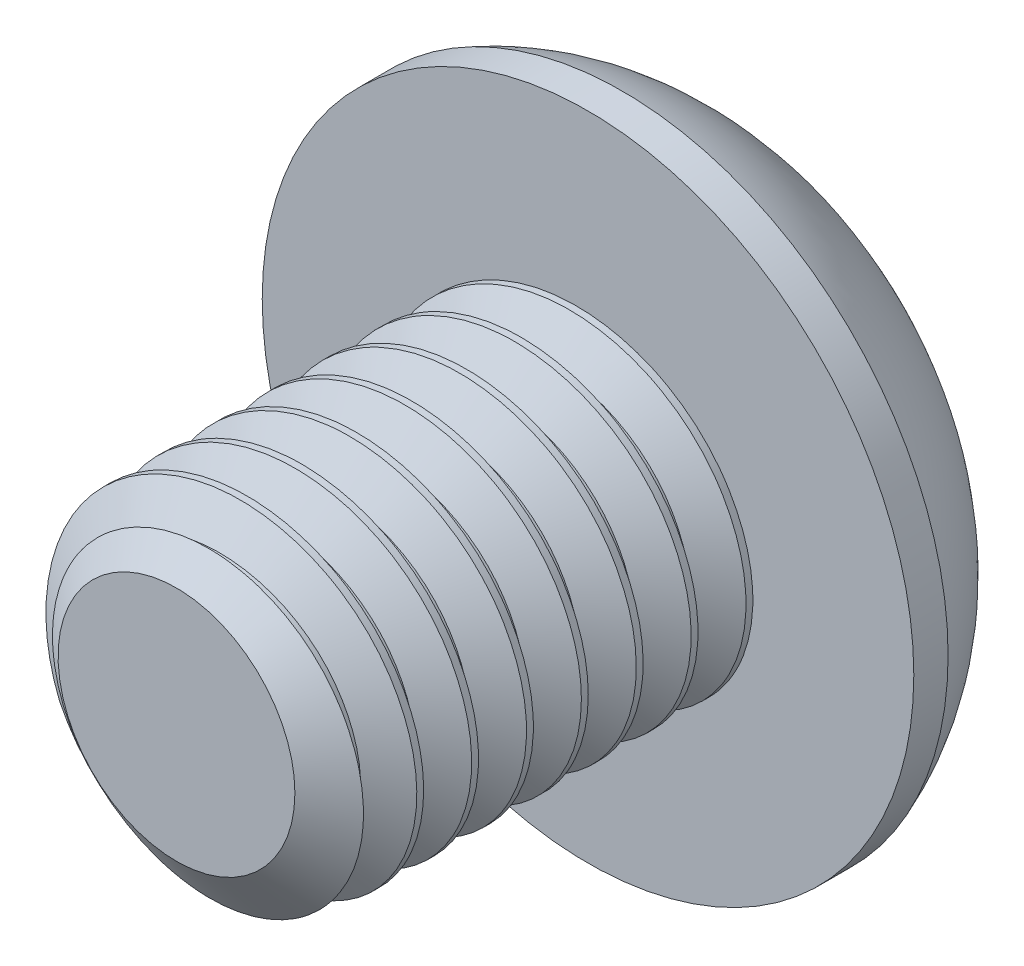
from build123d import *

# Parameters (mm, degrees)
SKETCH1_R          = 2.5
EXTRUDE1_DEPTH     = 6
CUT_SWEEP1_PITCH   = 0.7999999999999978
SKETCH6_R          = 4.75
EXTRUDE2_DEPTH     = 2.75
CUT_EXTRUDE1_DEPTH = 2.25
SKETCH8_R          = 1.7320508075688774
CUT_EXTRUDE2_DEPTH = 12.031205901894861
CUT_EXTRUDE2_TAPER = 45.0000000000001


with BuildPart() as part:
    # Sketch1 → Extrude1 (new body)
    with BuildSketch(Plane.XY):
        Circle(SKETCH1_R)
    extrude(amount=-EXTRUDE1_DEPTH)

    # Cut-Sweep1: the profile of Sketch3 profile screwed along a right-hand helix of 8.5 turns, 6 arcs to a turn; built about Z, then put on its axis
    cut_sweep1_z = Axis((0, 0, 0), (0, 0, 1))
    cut_sweep1_corners = [(2.5003, 0, -0.700173205), (1.980384758, 0, -0.4), (1.980384758, 0, -0.3), (2.5003, 0, 0.000173205)]
    with BuildLine(mode=Mode.PRIVATE) as cut_sweep1_profile:
        Line(cut_sweep1_corners[0], cut_sweep1_corners[1])
        Line(cut_sweep1_corners[1], cut_sweep1_corners[2])
        Line(cut_sweep1_corners[2], cut_sweep1_corners[3])
        Line(cut_sweep1_corners[3], cut_sweep1_corners[0])
    cut_sweep1_cap = Face(cut_sweep1_profile.wire())
    cut_sweep1_turn_angles = [0, 30, 60, 90, 120, 150, 180, 210, 240, 270, 300, 330, 360]
    cut_sweep1_turn_weights = [1, 0.8660254037844387, 1, 0.8660254037844387, 1, 0.8660254037844387, 1, 0.8660254037844387, 1, 0.8660254037844387, 1, 0.8660254037844387, 1]
    cut_sweep1_turn_rails = [Edge.make_bspline([Vector(p[0], p[1], 0).rotate(cut_sweep1_z, cut_sweep1_turn_angles[k]) / cut_sweep1_turn_weights[k] + Vector(0, 0, p[2] + CUT_SWEEP1_PITCH * cut_sweep1_turn_angles[k] / 360) for k in range(13)], [0, 0, 0, 1, 1, 2, 2, 3, 3, 4, 4, 5, 5, 6, 6, 6], 2, cut_sweep1_turn_weights) for p in cut_sweep1_corners]
    cut_sweep1_turn_sides = [Face.make_surface_from_curves(cut_sweep1_turn_rails[p[0]], cut_sweep1_turn_rails[p[1]]) for p in [(0, 1), (1, 2), (2, 3), (3, 0)]]
    cut_sweep1_last_angles = [2880, 2910, 2940, 2970, 3000, 3030, 3060]
    cut_sweep1_last_weights = [1, 0.8660254037844387, 1, 0.8660254037844387, 1, 0.8660254037844287, 1]
    cut_sweep1_last_rails = [Edge.make_bspline([Vector(p[0], p[1], 0).rotate(cut_sweep1_z, cut_sweep1_last_angles[k]) / cut_sweep1_last_weights[k] + Vector(0, 0, p[2] + CUT_SWEEP1_PITCH * cut_sweep1_last_angles[k] / 360) for k in range(7)], [0, 0, 0, 1, 1, 2, 2, 3, 3, 3], 2, cut_sweep1_last_weights) for p in cut_sweep1_corners]
    cut_sweep1_last_sides = [Face.make_surface_from_curves(cut_sweep1_last_rails[p[0]], cut_sweep1_last_rails[p[1]]) for p in [(0, 1), (1, 2), (2, 3), (3, 0)]]
    cut_sweep1 = Plane(origin=(0, 0, 0), x_dir=(-3.49e-15, 1, 0), z_dir=(0, 0, -1)) * Solid(Shell([*[p.moved(Location((0, 0, CUT_SWEEP1_PITCH * i))) for i in range(8) for p in cut_sweep1_turn_sides], *cut_sweep1_last_sides, cut_sweep1_cap, cut_sweep1_cap.rotate(cut_sweep1_z, 3060).moved(Location((0, 0, CUT_SWEEP1_PITCH * 3060 / 360)))]))
    add(cut_sweep1, mode=Mode.SUBTRACT)

    # Sketch4 → Cut-Revolve1 (revolve, cut)
    with BuildSketch(Plane(origin=(0, 0, 0), x_dir=(0, 0, -1), z_dir=(1, 0, 0)), mode=Mode.PRIVATE) as cut_revolve1_sk:
        Polygon((0.5416912243118476, 2.5), (0, 1.7263847577293348), (0, 2.5), align=None)
    revolve(cut_revolve1_sk.sketch.rotate(Axis((0, 0, 0), (0, 0, -1)), 260.43858876), axis=Axis((0, 0, 0), (0, 0, -1)), mode=Mode.SUBTRACT)

    # Sketch6 → Extrude2 (add)
    with BuildSketch(Plane(origin=(0, 0, -6), x_dir=(-1, 0, 0), z_dir=(0, 0, -1))):
        Circle(SKETCH6_R)
    extrude(amount=EXTRUDE2_DEPTH)

    # Sketch10 → Cut-Revolve2 (revolve, cut)
    with BuildSketch(Plane(origin=(0, 0, 0), x_dir=(0, 0, -1), z_dir=(1, 0, 0)), mode=Mode.PRIVATE) as cut_revolve2_sk:
        with BuildLine():
            Line((6.499999999999999, 4.75), (6.499999999999999, 5.25))
            Line((6.499999999999999, 5.25), (9.250000000000002, 5.25))
            Line((9.250000000000002, 5.25), (9.250000000000002, 1.5000000000000004))
            Line((9.250000000000002, 1.5000000000000004), (8.75, 1.5000000000000004))
            ThreePointArc((8.75, 1.5000000000000004), (8.132611776540898, 3.4764235376052373), (6.499999999999999, 4.75))
        make_face()
    revolve(cut_revolve2_sk.sketch.rotate(Axis((0, 0, 0), (0, 0, -1)), 90), axis=Axis((0, 0, 0), (0, 0, -1)), mode=Mode.SUBTRACT)

    # Sketch7 → Cut-Extrude1 (cut)
    with BuildSketch(Plane(origin=(0, 0, -8.75), x_dir=(-1, 0, 0), z_dir=(0, 0, -1))):
        Polygon((-2.6e-16, 1.7320508075688774), (-1.5, 0.8660254037844389), (-1.5, -0.8660254037844387), (1e-16, -1.7320508075688774), (1.5000000000000009, -0.8660254037844387), (1.5000000000000002, 0.8660254037844387), align=None)
    extrude(amount=-CUT_EXTRUDE1_DEPTH, mode=Mode.SUBTRACT)

    # Sketch8 → Cut-Extrude2 (cut, through all)
    with BuildSketch(Plane.XY.offset(-8.75)):
        Circle(SKETCH8_R)
    extrude(amount=CUT_EXTRUDE2_DEPTH, taper=CUT_EXTRUDE2_TAPER, mode=Mode.SUBTRACT)


solid = part.part
